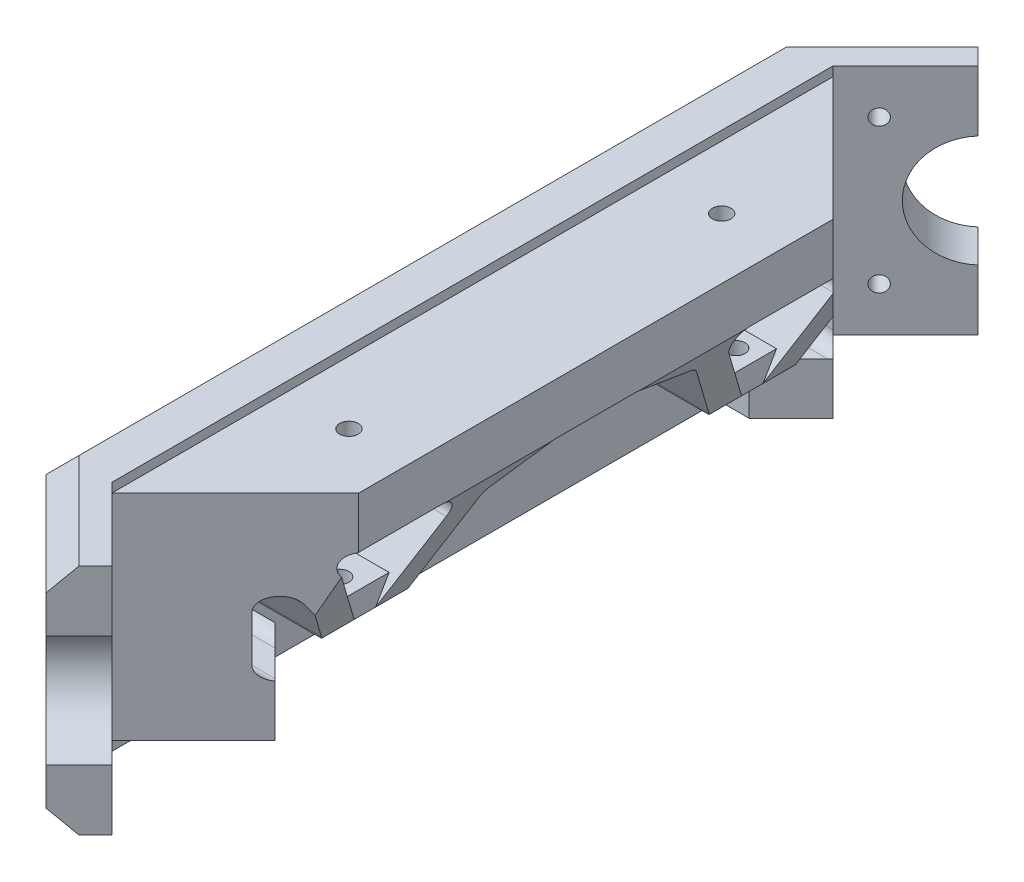
from build123d import *

# Parameters (mm, degrees)
EXTRUDE_1_DEPTH          = 50
SKETCH_3_R               = 1.7
CUT_EXTRUDE_1_DEPTH      = 60
SKETCH_4_R               = 1.7
CUT_EXTRUDE_2_DEPTH      = 60
SKETCH_5_R               = 12
CUT_EXTRUDE_3_DEPTH      = 10
CUT_EXTRUDE_4_DEPTH      = 2
SKETCH_8_W               = 26.485281374
SKETCH_8_H               = 101.774603256
CUT_EXTRUDE_5_DEPTH      = 15
SKETCH_10_R              = 12
CUT_EXTRUDE_6_DEPTH      = 10
CUT_EXTRUDE_8_DEPTH      = 190.166593245
FILLET_1_DEPTH           = 34.131548767
FILLET_1_2_DEPTH         = 13.514718626
FILLET_START             = 31.533472555
FILLET_1_3_DEPTH         = 8.466527445
FILLET_START_2           = 13.514718626
FILLET_1_4_DEPTH         = 18.018753929
FILLET_START_3           = 9.112698372
FILLET_1_5_OUTLINE_W     = 89.421356237
FILLET_1_5_OUTLINE_H     = 24
FILLET_1_5_DEPTH         = 4.887301628
FILLET_START_4           = -99.245144302
FILLET_1_6_OUTLINE_W     = 5.578643763
FILLET_1_6_OUTLINE_H     = 24
FILLET_1_6_DEPTH         = 84.223193089
CHAMFER_1_SIZE           = 5
CUT_EXTRUDE_9_DEPTH      = 3
CUT_EXTRUDE_9_DEPTH_BACK = 187.153162745
SKETCH_13_R              = 2
CUT_EXTRUDE_10_DEPTH     = 2
SKETCH_17_W              = 10.485281374
SKETCH_17_H              = 18.591857057
EXTRUDE_2_DEPTH          = 5
CHAMFER_2_SIZE           = 2
SKETCH_18_R              = 2
CUT_EXTRUDE_12_DEPTH     = 5
CUT_EXTRUDE_START        = -26.485281374
CUT_EXTRUDE_14_DEPTH     = 26.485281374
CHAMFER_START            = 2
CHAMFER_4_DEPTH          = 12.939420175
SKETCH_21_R              = 2
CUT_EXTRUDE_15_DEPTH     = 20
CUT_EXTRUDE_21_DEPTH     = 140


with BuildPart() as part:
    # 草图1 → 凸台-拉伸1 (new body)
    with BuildSketch(Plane(origin=(0, 0, 0), x_dir=(1, 0, 0), z_dir=(0, 1, 0))):
        Polygon((0, 0), (0, 156), (22, 178), (29.071067812, 170.928932188), (13.514718626, 155.372583002), (40, 128.887301628), (40, 27.112698372), (13.514718626, 0.627416998), (29.071067812, -14.928932188), (22, -22), align=None)
    extrude(amount=EXTRUDE_1_DEPTH)

    # 草图3 → 切除-拉伸1 (cut)
    with BuildSketch(Plane(origin=(7.071067812, 0, -7.071067812), x_dir=(-0.7071067811865475, 0, -0.7071067811865477), z_dir=(0.7071067811865477, 0, -0.7071067811865475))):
        with Locations((-16.112698372, 40.5)):
            Circle(SKETCH_3_R)
        with Locations((-16.112698372, 9.5)):
            Circle(SKETCH_3_R)
    extrude(amount=-CUT_EXTRUDE_1_DEPTH, mode=Mode.SUBTRACT)

    # 草图4 → 切除-拉伸2 (cut)
    with BuildSketch(Plane(origin=(-70.928932188, 0, -70.928932188), x_dir=(0.7071067811865397, 0, -0.7071067811865555), z_dir=(0.7071067811865555, 0, 0.7071067811865397))):
        with Locations((126.421356237, 40.5)):
            Circle(SKETCH_4_R)
        with Locations((126.421356237, 9.5)):
            Circle(SKETCH_4_R)
    extrude(amount=-CUT_EXTRUDE_2_DEPTH, mode=Mode.SUBTRACT)

    # 草图5 → 切除-拉伸3 (cut)
    with BuildSketch(Plane(origin=(0, 0, 0), x_dir=(0.7071067811865474, 0, 0.7071067811865477), z_dir=(-0.7071067811865477, 0, 0.7071067811865474))):
        with Locations((31.612698372, 25)):
            Circle(SKETCH_5_R)
    extrude(amount=-CUT_EXTRUDE_3_DEPTH, mode=Mode.SUBTRACT)

    # 草图7 → 切除-拉伸4 (cut)
    with BuildSketch(Plane.XZ):
        Polygon((13.514718626, -0.627416998), (13.514718626, -155.372583002), (40, -128.887301628), (40, -27.112698372), align=None)
    extrude(amount=-CUT_EXTRUDE_4_DEPTH, mode=Mode.SUBTRACT)

    # 草图8 → 切除-拉伸5 (cut)
    with BuildSketch(Plane.XZ.offset(-2)):
        with Locations((26.757359313, -78)):
            Rectangle(SKETCH_8_W, SKETCH_8_H)
    extrude(amount=-CUT_EXTRUDE_5_DEPTH, mode=Mode.SUBTRACT)

    # 草图10 → 切除-拉伸6 (cut)
    with BuildSketch(Plane(origin=(-78, 0, -78), x_dir=(-0.7071067811865404, 0, 0.7071067811865548), z_dir=(-0.7071067811865548, 0, -0.7071067811865404))):
        with Locations((-141.921356237, 25)):
            Circle(SKETCH_10_R)
    extrude(amount=-CUT_EXTRUDE_6_DEPTH, mode=Mode.SUBTRACT)

    # 草图12 → 切除-拉伸8 (cut, through all)
    with BuildSketch(Plane.ZY):
        Polygon((-98.784609691, 37), (-112.641016151, 13), (-84.92820323, 13), align=None)
        Polygon((-91.856406461, 37), (-78, 13), (-64.143593539, 37), align=None)
        Polygon((-57.215390309, 37), (-71.07179677, 13), (-43.358983849, 13), align=None)
        Polygon((-140.353829072, 37), (-140.353829072, 13), (-126.497422612, 13), align=None)
        Polygon((-133.425625842, 37), (-105.712812921, 37), (-119.569219382, 13), align=None)
        Polygon((-50.287187079, 37), (-36.430780618, 13), (-22.574374158, 37), align=None)
        Polygon((-15.646170928, 37), (-29.502577388, 13), (-15.646170928, 13), align=None)
    extrude(amount=-CUT_EXTRUDE_8_DEPTH, mode=Mode.SUBTRACT)

    # 圆角1: read off the stored shape, not the designer's step
    # 圆角1 outline → 圆角1 (add)
    with BuildSketch(Plane.YZ):
        with BuildLine():
            Line((17, -27.13485209), (17, -27.193176311))
            Line((17, -27.193176311), (17.5, -26.904501177))
            ThreePointArc((17.5, -26.904501177), (17.25529494, -27.031169837), (17, -27.13485209))
        make_face()
        with BuildLine():
            Line((17, -38.666848596), (17, -38.740181695))
            Line((17, -38.740181695), (17.5, -39.02885683))
            ThreePointArc((17.5, -39.02885683), (17.240664191, -38.860747184), (17, -38.666848596))
        make_face()
        with BuildLine():
            Line((17, -68.704071471), (17, -68.762395693))
            Line((17, -68.762395693), (17.5, -68.473720558))
            ThreePointArc((17.5, -68.473720558), (17.25529494, -68.600389218), (17, -68.704071471))
        make_face()
        with BuildLine():
            Line((17, -80.236067977), (17, -80.309401077))
            Line((17, -80.309401077), (17.5, -80.598076211))
            ThreePointArc((17.5, -80.598076211), (17.240664191, -80.429966565), (17, -80.236067977))
        make_face()
        with BuildLine():
            Line((17, -110.273290853), (17, -110.331615075))
            Line((17, -110.331615075), (17.5, -110.04293994))
            ThreePointArc((17.5, -110.04293994), (17.25529494, -110.1696086), (17, -110.273290853))
        make_face()
        with BuildLine():
            Line((17, -121.805287359), (17, -121.878620458))
            Line((17, -121.878620458), (17.5, -122.167295593))
            ThreePointArc((17.5, -122.167295593), (17.240664191, -121.999185947), (17, -121.805287359))
        make_face()
        with BuildLine():
            Line((14.939420175, -128.887301627), (13, -128.887301628))
            Line((13, -128.887301628), (13, -131.693575035))
            ThreePointArc((13, -131.693575035), (13.532031252, -129.987957767), (14.939420175, -128.887301627))
        make_face()
        with BuildLine():
            Line((17, -128.806823689), (17, -128.86514791))
            ThreePointArc((17, -128.86514791), (17.25529494, -128.968830163), (17.5, -129.095498823))
            Line((17.5, -129.095498823), (17, -128.806823689))
        make_face()
        with BuildLine():
            Line((37, -140.353829072), (27.303847577, -134.755752861))
            ThreePointArc((27.303847577, -134.755752861), (28.701625056, -138.130286208), (25.803847577, -140.353829072))
            Line((25.803847577, -140.353829072), (37, -140.353829072))
        make_face()
        with BuildLine():
            Line((17.5, -116.97114317), (17, -117.259818305))
            Line((17, -117.259818305), (17, -117.333151404))
            ThreePointArc((17, -117.333151404), (17.240664191, -117.139252816), (17.5, -116.97114317))
        make_face()
        with BuildLine():
            ThreePointArc((37, -128.229473419), (35.5, -130.827549631), (32.5, -130.827549631))
            Line((32.5, -130.827549631), (37, -133.425625842))
            Line((37, -133.425625842), (37, -128.229473419))
        make_face()
        with BuildLine():
            Line((37, -105.712812921), (32.5, -108.310889132))
            ThreePointArc((32.5, -108.310889132), (35.5, -108.310889132), (37, -110.908965344))
            Line((37, -110.908965344), (37, -105.712812921))
        make_face()
        with BuildLine():
            ThreePointArc((32.5, -96.186533479), (34, -98.784609691), (32.5, -101.382685902))
            Line((32.5, -101.382685902), (37, -98.784609691))
            Line((37, -98.784609691), (32.5, -96.186533479))
        make_face()
        with BuildLine():
            Line((17, -87.237604307), (17, -87.295928529))
            ThreePointArc((17, -87.295928529), (17.25529494, -87.399610782), (17.5, -87.526279442))
            Line((17.5, -87.526279442), (17, -87.237604307))
        make_face()
        with BuildLine():
            Line((17.5, -75.401923789), (17, -75.690598923))
            Line((17, -75.690598923), (17, -75.763932023))
            ThreePointArc((17, -75.763932023), (17.240664191, -75.570033435), (17.5, -75.401923789))
        make_face()
        with BuildLine():
            ThreePointArc((37, -86.660254038), (35.5, -89.258330249), (32.5, -89.258330249))
            Line((32.5, -89.258330249), (37, -91.856406461))
            Line((37, -91.856406461), (37, -86.660254038))
        make_face()
        with BuildLine():
            Line((37, -64.143593539), (32.5, -66.741669751))
            ThreePointArc((32.5, -66.741669751), (35.5, -66.741669751), (37, -69.339745962))
            Line((37, -69.339745962), (37, -64.143593539))
        make_face()
        with BuildLine():
            ThreePointArc((32.5, -54.617314098), (34, -57.21539031), (32.5, -59.813466521))
            Line((32.5, -59.813466521), (37, -57.215390309))
            Line((37, -57.215390309), (32.5, -54.617314098))
        make_face()
        with BuildLine():
            Line((17, -45.668384925), (17, -45.726709147))
            ThreePointArc((17, -45.726709147), (17.25529494, -45.8303914), (17.5, -45.95706006))
            Line((17.5, -45.95706006), (17, -45.668384925))
        make_face()
        with BuildLine():
            Line((17.5, -33.832704407), (17, -34.121379541))
            Line((17, -34.121379541), (17, -34.194712641))
            ThreePointArc((17, -34.194712641), (17.240664191, -34.000814053), (17.5, -33.832704407))
        make_face()
        with BuildLine():
            ThreePointArc((37, -45.091034656), (35.5, -47.689110868), (32.5, -47.689110868))
            Line((32.5, -47.689110868), (37, -50.287187079))
            Line((37, -50.287187079), (37, -45.091034656))
        make_face()
        with BuildLine():
            Line((37, -22.574374158), (32.5, -25.172450369))
            ThreePointArc((32.5, -25.172450369), (35.5, -25.172450369), (37, -27.770526581))
            Line((37, -27.770526581), (37, -22.574374158))
        make_face()
        with BuildLine():
            Line((13, -24.306424965), (13, -27.112698372))
            Line((13, -27.112698372), (14.939420175, -27.112698373))
            ThreePointArc((14.939420175, -27.112698373), (13.532031252, -26.012042233), (13, -24.306424965))
        make_face()
        with BuildLine():
            ThreePointArc((25.803847577, -15.646170928), (28.701625056, -17.869713792), (27.303847577, -21.244247139))
            Line((27.303847577, -21.244247139), (37, -15.646170928))
            Line((37, -15.646170928), (25.803847577, -15.646170928))
        make_face()
    extrude(amount=FILLET_1_DEPTH)

    # Fillet 1 2 outline → Fillet 1 2 (add)
    with BuildSketch(Plane.YZ):
        with BuildLine():
            Line((13, -126.497422612), (13, -128.887301628))
            Line((13, -128.887301628), (14.939420175, -128.887301627))
            ThreePointArc((14.939420175, -128.887301627), (15.967748246, -128.693748402), (17, -128.86514791))
            Line((17, -128.86514791), (17, -128.806823689))
            Line((17, -128.806823689), (13, -126.497422612))
        make_face()
        with BuildLine():
            Line((13, -29.502577388), (17, -27.193176311))
            Line((17, -27.193176311), (17, -27.13485209))
            ThreePointArc((17, -27.13485209), (15.967748246, -27.306251598), (14.939420175, -27.112698373))
            Line((14.939420175, -27.112698373), (13, -27.112698372))
            Line((13, -27.112698372), (13, -29.502577388))
        make_face()
        with BuildLine():
            Line((13, -36.430780618), (17, -38.740181695))
            Line((17, -38.740181695), (17, -38.666848596))
            ThreePointArc((17, -38.666848596), (16, -36.430780619), (17, -34.194712641))
            Line((17, -34.194712641), (17, -34.121379542))
            Line((17, -34.121379542), (13, -36.430780618))
        make_face()
        with BuildLine():
            Line((13, -71.07179677), (17, -68.762395693))
            Line((17, -68.762395693), (17, -68.704071471))
            ThreePointArc((17, -68.704071471), (14.267949192, -68.325134089), (13, -65.875644347))
            Line((13, -65.875644347), (13, -71.07179677))
        make_face()
        with BuildLine():
            Line((13, -78), (17, -80.309401077))
            Line((17, -80.309401077), (17, -80.236067977))
            ThreePointArc((17, -80.236067977), (16, -78), (17, -75.763932023))
            Line((17, -75.763932023), (17, -75.690598923))
            Line((17, -75.690598923), (13, -78))
        make_face()
        with BuildLine():
            Line((13, -112.641016151), (17, -110.331615075))
            Line((17, -110.331615075), (17, -110.273290853))
            ThreePointArc((17, -110.273290853), (14.267949193, -109.894353472), (13, -107.444863729))
            Line((13, -107.444863729), (13, -112.641016151))
        make_face()
        with BuildLine():
            Line((13, -119.569219382), (17, -121.878620458))
            Line((17, -121.878620458), (17, -121.805287359))
            ThreePointArc((17, -121.805287359), (16, -119.569219382), (17, -117.333151404))
            Line((17, -117.333151404), (17, -117.259818305))
            Line((17, -117.259818305), (13, -119.569219382))
        make_face()
        with BuildLine():
            ThreePointArc((16, -140.353829072), (13.878679656, -139.475149416), (13, -137.353829072))
            Line((13, -137.353829072), (13, -140.353829072))
            Line((13, -140.353829072), (16, -140.353829072))
        make_face()
        with BuildLine():
            Line((13, -84.92820323), (13, -90.124355653))
            ThreePointArc((13, -90.124355653), (14.267949192, -87.674865911), (17, -87.295928529))
            Line((17, -87.295928529), (17, -87.237604307))
            Line((17, -87.237604307), (13, -84.92820323))
        make_face()
        with BuildLine():
            Line((13, -43.358983849), (13, -48.555136271))
            ThreePointArc((13, -48.555136271), (14.267949193, -46.105646528), (17, -45.726709147))
            Line((17, -45.726709147), (17, -45.668384925))
            Line((17, -45.668384925), (13, -43.358983849))
        make_face()
        with BuildLine():
            Line((13, -15.646170928), (13, -18.646170928))
            ThreePointArc((13, -18.646170928), (13.878679656, -16.524850584), (16, -15.646170928))
            Line((16, -15.646170928), (13, -15.646170928))
        make_face()
    extrude(amount=FILLET_1_2_DEPTH)

    # Fillet 1 3 outline → Fillet 1 3 (add)
    with BuildSketch(Plane.YZ.offset(FILLET_START)):
        with BuildLine():
            Line((17, -27.13485209), (17, -27.193176311))
            Line((17, -27.193176311), (17.5, -26.904501177))
            ThreePointArc((17.5, -26.904501177), (17.25529494, -27.031169837), (17, -27.13485209))
        make_face()
        with BuildLine():
            Line((17, -38.666848596), (17, -38.740181695))
            Line((17, -38.740181695), (17.5, -39.02885683))
            ThreePointArc((17.5, -39.02885683), (17.240664191, -38.860747184), (17, -38.666848596))
        make_face()
        with BuildLine():
            Line((17, -68.704071471), (17, -68.762395693))
            Line((17, -68.762395693), (17.5, -68.473720558))
            ThreePointArc((17.5, -68.473720558), (17.25529494, -68.600389218), (17, -68.704071471))
        make_face()
        with BuildLine():
            Line((17, -80.236067977), (17, -80.309401077))
            Line((17, -80.309401077), (17.5, -80.598076211))
            ThreePointArc((17.5, -80.598076211), (17.240664191, -80.429966565), (17, -80.236067977))
        make_face()
        with BuildLine():
            Line((17, -110.273290853), (17, -110.331615075))
            Line((17, -110.331615075), (17.5, -110.04293994))
            ThreePointArc((17.5, -110.04293994), (17.25529494, -110.1696086), (17, -110.273290853))
        make_face()
        with BuildLine():
            Line((17, -121.805287359), (17, -121.878620458))
            Line((17, -121.878620458), (17.5, -122.167295593))
            ThreePointArc((17.5, -122.167295593), (17.240664191, -121.999185947), (17, -121.805287359))
        make_face()
        with BuildLine():
            Line((14.939420175, -128.887301627), (13, -128.887301628))
            Line((13, -128.887301628), (13, -131.693575035))
            ThreePointArc((13, -131.693575035), (13.532031252, -129.987957767), (14.939420175, -128.887301627))
        make_face()
        with BuildLine():
            Line((17, -128.806823689), (17, -128.86514791))
            ThreePointArc((17, -128.86514791), (17.25529494, -128.968830163), (17.5, -129.095498823))
            Line((17.5, -129.095498823), (17, -128.806823689))
        make_face()
        with BuildLine():
            Line((17.5, -116.97114317), (17, -117.259818305))
            Line((17, -117.259818305), (17, -117.333151404))
            ThreePointArc((17, -117.333151404), (17.240664191, -117.139252816), (17.5, -116.97114317))
        make_face()
        with BuildLine():
            ThreePointArc((37, -128.229473419), (35.5, -130.827549631), (32.5, -130.827549631))
            Line((32.5, -130.827549631), (37, -133.425625842))
            Line((37, -133.425625842), (37, -128.229473419))
        make_face()
        with BuildLine():
            Line((37, -105.712812921), (32.5, -108.310889132))
            ThreePointArc((32.5, -108.310889132), (35.5, -108.310889132), (37, -110.908965344))
            Line((37, -110.908965344), (37, -105.712812921))
        make_face()
        with BuildLine():
            ThreePointArc((32.5, -96.186533479), (34, -98.784609691), (32.5, -101.382685902))
            Line((32.5, -101.382685902), (37, -98.784609691))
            Line((37, -98.784609691), (32.5, -96.186533479))
        make_face()
        with BuildLine():
            Line((17, -87.237604307), (17, -87.295928529))
            ThreePointArc((17, -87.295928529), (17.25529494, -87.399610782), (17.5, -87.526279442))
            Line((17.5, -87.526279442), (17, -87.237604307))
        make_face()
        with BuildLine():
            Line((17.5, -75.401923789), (17, -75.690598923))
            Line((17, -75.690598923), (17, -75.763932023))
            ThreePointArc((17, -75.763932023), (17.240664191, -75.570033435), (17.5, -75.401923789))
        make_face()
        with BuildLine():
            ThreePointArc((37, -86.660254038), (35.5, -89.258330249), (32.5, -89.258330249))
            Line((32.5, -89.258330249), (37, -91.856406461))
            Line((37, -91.856406461), (37, -86.660254038))
        make_face()
        with BuildLine():
            Line((37, -64.143593539), (32.5, -66.741669751))
            ThreePointArc((32.5, -66.741669751), (35.5, -66.741669751), (37, -69.339745962))
            Line((37, -69.339745962), (37, -64.143593539))
        make_face()
        with BuildLine():
            ThreePointArc((32.5, -54.617314098), (34, -57.21539031), (32.5, -59.813466521))
            Line((32.5, -59.813466521), (37, -57.215390309))
            Line((37, -57.215390309), (32.5, -54.617314098))
        make_face()
        with BuildLine():
            Line((17, -45.668384925), (17, -45.726709147))
            ThreePointArc((17, -45.726709147), (17.25529494, -45.8303914), (17.5, -45.95706006))
            Line((17.5, -45.95706006), (17, -45.668384925))
        make_face()
        with BuildLine():
            Line((17.5, -33.832704407), (17, -34.121379541))
            Line((17, -34.121379541), (17, -34.194712641))
            ThreePointArc((17, -34.194712641), (17.240664191, -34.000814053), (17.5, -33.832704407))
        make_face()
        with BuildLine():
            ThreePointArc((37, -45.091034656), (35.5, -47.689110868), (32.5, -47.689110868))
            Line((32.5, -47.689110868), (37, -50.287187079))
            Line((37, -50.287187079), (37, -45.091034656))
        make_face()
        with BuildLine():
            Line((37, -22.574374158), (32.5, -25.172450369))
            ThreePointArc((32.5, -25.172450369), (35.5, -25.172450369), (37, -27.770526581))
            Line((37, -27.770526581), (37, -22.574374158))
        make_face()
        with BuildLine():
            Line((13, -24.306424965), (13, -27.112698372))
            Line((13, -27.112698372), (14.939420175, -27.112698373))
            ThreePointArc((14.939420175, -27.112698373), (13.532031252, -26.012042233), (13, -24.306424965))
        make_face()
    extrude(amount=FILLET_1_3_DEPTH)

    # Fillet 1 4 outline → Fillet 1 4 (add)
    with BuildSketch(Plane.YZ.offset(FILLET_START_2)):
        with BuildLine():
            ThreePointArc((16, -140.353829072), (13.878679656, -139.475149416), (13, -137.353829072))
            Line((13, -137.353829072), (13, -140.353829072))
            Line((13, -140.353829072), (16, -140.353829072))
        make_face()
        with BuildLine():
            Line((13, -15.646170928), (13, -18.646170928))
            ThreePointArc((13, -18.646170928), (13.878679656, -16.524850584), (16, -15.646170928))
            Line((16, -15.646170928), (13, -15.646170928))
        make_face()
    extrude(amount=FILLET_1_4_DEPTH)

    # Fillet 1 5 outline → Fillet 1 5 (cut)
    with BuildSketch(Plane(origin=(0, 0, 0), x_dir=(0.7071067811865474, 0, -0.7071067811865477), z_dir=(0.7071067811865476, 0, 0.7071067811865476)).offset(FILLET_START_3)):
        with Locations((74.710678119, 25)):
            Rectangle(FILLET_1_5_OUTLINE_W, FILLET_1_5_OUTLINE_H)
    extrude(amount=FILLET_1_5_DEPTH, mode=Mode.SUBTRACT)

    # Fillet 1 6 outline → Fillet 1 6 (cut)
    with BuildSketch(Plane(origin=(0, 0, 0), x_dir=(0.7071067811865474, 0, -0.7071067811865477), z_dir=(0.7071067811865476, 0, 0.7071067811865476)).offset(FILLET_START_4)):
        with Locations((122.210678119, 25)):
            Rectangle(FILLET_1_6_OUTLINE_W, FILLET_1_6_OUTLINE_H)
    extrude(amount=FILLET_1_6_DEPTH, mode=Mode.SUBTRACT)

    # 倒角1
    chamfer_1_edges = [part.edges().sort_by_distance(p)[0] for p in [
        (0, 0, -78),
        (11, 0, -167),
        (11, 0, 11),
        (11, 50, -167),
        (0, 50, -78),
        (11, 50, 11),
    ]]
    chamfer(chamfer_1_edges, length=CHAMFER_1_SIZE)

    # 草图13 → 切除-拉伸9 (cut, two sides: drawn at the far end of the back side and taken through both)
    with BuildSketch(Plane(origin=(0, 13, 0), x_dir=(1, 0, 0), z_dir=(0, 1, 0)).offset(-CUT_EXTRUDE_9_DEPTH_BACK)):
        with Locations(Location((21.514718626, 136.353829072, 0), (0, 0, 150))):
            Circle(SKETCH_13_R)
        with Locations(Location((21.514718626, 19.646170928, 0), (0, 0, 330))):
            Circle(SKETCH_13_R)
    extrude(amount=CUT_EXTRUDE_9_DEPTH + CUT_EXTRUDE_9_DEPTH_BACK, mode=Mode.SUBTRACT)

    # 草图14 → 切除-拉伸10 (cut)
    with BuildSketch(Plane(origin=(0, 50, 0), x_dir=(1, 0, 0), z_dir=(0, 1, 0))):
        Polygon((40, 27.112698372), (40, 128.887301628), (13.514718626, 155.372583002), (13.514718626, 0.627416998), align=None)
    extrude(amount=-CUT_EXTRUDE_10_DEPTH, mode=Mode.SUBTRACT)

    # 草图17 → 凸台-拉伸2 (add)
    with BuildSketch(Plane.XZ.offset(-17)):
        with Locations((26.757359313, -119.569219382)):
            Rectangle(SKETCH_17_W, SKETCH_17_H)
        with Locations((26.757359313, -36.430780619)):
            Rectangle(SKETCH_17_W, SKETCH_17_H)
    extrude(amount=-EXTRUDE_2_DEPTH)

    # 倒角2
    # the kernel refuses this chamfer: 2 mm, written as the material it adds along each edge
    with BuildSketch(Plane(origin=(21.514718626, 26.454285596, -44.198616029), x_dir=(-1, 0, 0), z_dir=(0, -0.8660254037844363, 0.5000000000000043))) as chamfer_2_piece_1_section:
        Polygon((CHAMFER_2_SIZE, 0), (0, -CHAMFER_2_SIZE), (0, 0), align=None)
    chamfer_2_piece_1 = extrude(amount=15.482884374, mode=Mode.PRIVATE)
    chamfer_2_piece_1 = split(chamfer_2_piece_1, bisect_by=Plane(origin=(21.514718626, 22, -44.198616029), z_dir=(0, -1, 0)), keep=Keep.TOP, mode=Mode.PRIVATE)
    chamfer_2_piece_1 = split(chamfer_2_piece_1, bisect_by=Plane(origin=(21.514718626, 17, -44.198616029), z_dir=(0, 1, 0)), keep=Keep.TOP, mode=Mode.PRIVATE)
    add(chamfer_2_piece_1)
    with BuildSketch(Plane(origin=(21.514718626, 13.045714404, -36.404387395), x_dir=(-1, 0, 0), z_dir=(0, 0.8660254037844412, 0.49999999999999584))) as chamfer_2_piece_2_section:
        Polygon((CHAMFER_2_SIZE, 0), (0, -CHAMFER_2_SIZE), (0, 0), align=None)
    chamfer_2_piece_2 = extrude(amount=15.482884375, mode=Mode.PRIVATE)
    chamfer_2_piece_2 = split(chamfer_2_piece_2, bisect_by=Plane(origin=(21.514718626, 22, -36.404387395), z_dir=(0, -1, 0)), keep=Keep.TOP, mode=Mode.PRIVATE)
    chamfer_2_piece_2 = split(chamfer_2_piece_2, bisect_by=Plane(origin=(21.514718626, 17, -36.404387395), z_dir=(0, 1, 0)), keep=Keep.TOP, mode=Mode.PRIVATE)
    add(chamfer_2_piece_2)
    with BuildSketch(Plane(origin=(21.514718626, 13.045714404, -119.542826158), x_dir=(-1, 0, 0), z_dir=(0, 0.8660254037844408, 0.49999999999999634))) as chamfer_2_piece_3_section:
        Polygon((CHAMFER_2_SIZE, 0), (0, -CHAMFER_2_SIZE), (0, 0), align=None)
    chamfer_2_piece_3 = extrude(amount=15.482884374, mode=Mode.PRIVATE)
    chamfer_2_piece_3 = split(chamfer_2_piece_3, bisect_by=Plane(origin=(21.514718626, 17, -119.542826158), z_dir=(0, 1, 0)), keep=Keep.TOP, mode=Mode.PRIVATE)
    chamfer_2_piece_3 = split(chamfer_2_piece_3, bisect_by=Plane(origin=(21.514718626, 22, -119.542826158), z_dir=(0, -1, 0)), keep=Keep.TOP, mode=Mode.PRIVATE)
    add(chamfer_2_piece_3)
    with BuildSketch(Plane(origin=(21.514718626, 26.454285596, -127.337054792), x_dir=(-1, 0, 0), z_dir=(0, -0.8660254037844364, 0.5000000000000041))) as chamfer_2_piece_4_section:
        Polygon((CHAMFER_2_SIZE, 0), (0, -CHAMFER_2_SIZE), (0, 0), align=None)
    chamfer_2_piece_4 = extrude(amount=15.482884375, mode=Mode.PRIVATE)
    chamfer_2_piece_4 = split(chamfer_2_piece_4, bisect_by=Plane(origin=(21.514718626, 17, -127.337054792), z_dir=(0, 1, 0)), keep=Keep.TOP, mode=Mode.PRIVATE)
    chamfer_2_piece_4 = split(chamfer_2_piece_4, bisect_by=Plane(origin=(21.514718626, 22, -127.337054792), z_dir=(0, -1, 0)), keep=Keep.TOP, mode=Mode.PRIVATE)
    add(chamfer_2_piece_4)

    # 草图18 → 切除-拉伸12 (cut)
    with BuildSketch(Plane.XZ.offset(-17)):
        with Locations(Location((27.514718626, -120.5, 0), (0, 0, 270))):
            Circle(SKETCH_18_R)
        with Locations(Location((27.514718626, -35.5, 0), (0, 0, 270))):
            Circle(SKETCH_18_R)
    extrude(amount=-CUT_EXTRUDE_12_DEPTH, mode=Mode.SUBTRACT)

    # 草图20 → 切除-拉伸14 (cut)
    with BuildSketch(Plane(origin=(40, 0, 0), x_dir=(0, 0, -1), z_dir=(1, 0, 0)).offset(CUT_EXTRUDE_START)):
        with BuildLine():
            Line((69.339745962, 37), (86.660254038, 37))
            ThreePointArc((86.660254038, 37), (87.023208518, 36.97796307), (87.38083073, 36.91217603))
            Line((87.38083073, 36.91217603), (99.505186383, 33.91217603))
            ThreePointArc((99.505186383, 33.91217603), (100.587919026, 33.39751443), (101.382685902, 32.5))
            Line((101.382685902, 32.5), (110.273290853, 17))
            Line((110.273290853, 17), (45.726709147, 17))
            Line((45.726709147, 17), (54.617314098, 32.5))
            ThreePointArc((54.617314098, 32.5), (55.412080974, 33.39751443), (56.494813617, 33.91217603))
            Line((56.494813617, 33.91217603), (68.61916927, 36.91217603))
            ThreePointArc((68.61916927, 36.91217603), (68.976791482, 36.97796307), (69.339745962, 37))
        make_face()
    extrude(amount=CUT_EXTRUDE_14_DEPTH, mode=Mode.SUBTRACT)

    # 倒角4: read off the stored shape, not the designer's step
    # 倒角4 outline → 倒角4 (cut)
    with BuildSketch(Plane(origin=(0, 0, 0), x_dir=(1, 0, 0), z_dir=(0, 1, 0)).offset(CHAMFER_START)):
        Polygon((40, 27.112698372), (22, 27.112698372), (31, 18.112698372), align=None)
        Polygon((40, 128.887301628), (31, 137.887301628), (22, 128.887301628), align=None)
    extrude(amount=CHAMFER_4_DEPTH, mode=Mode.SUBTRACT)

    # 草图21 → 切除-拉伸15 (cut)
    with BuildSketch(Plane(origin=(0, 48, 0), x_dir=(1, 0, 0), z_dir=(0, 1, 0))):
        with Locations(Location((27, 118, 0), (0, 0, 270))):
            Circle(SKETCH_21_R)
        with Locations(Location((27, 38, 0), (0, 0, 270))):
            Circle(SKETCH_21_R)
    extrude(amount=-CUT_EXTRUDE_15_DEPTH, mode=Mode.SUBTRACT)

    # 草图22 → 切除-拉伸21 (cut)
    with BuildSketch(Plane.XY):
        Polygon((32, 17), (40, 17), (40, 36.926988563), align=None)
    extrude(amount=-CUT_EXTRUDE_21_DEPTH, mode=Mode.SUBTRACT)


solid = part.part
